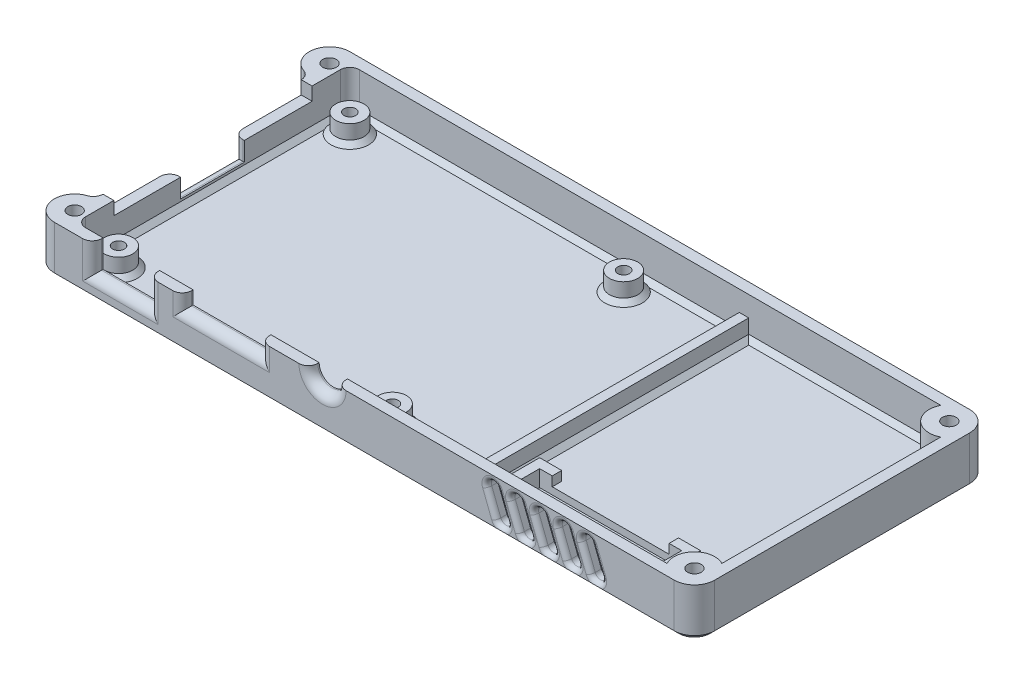
from build123d import *

# Parameters (mm, degrees)
SKETCH3_W                      = 135.6
SKETCH3_H                      = 62.6
SKETCH3_W_2                    = 131
SKETCH3_H_2                    = 58
BOSS_EXTRUDE1_DEPTH            = 10.3
SKETCH5_W                      = 131
SKETCH5_H                      = 58
BOSS_EXTRUDE2_DEPTH            = 2
SKETCH6_R                      = 3
BOSS_EXTRUDE3_DEPTH            = 4
F_2_5_2_5_DIAMETER_HOLE1_D     = 2.5
F_2_5_2_5_DIAMETER_HOLE1_DEPTH = 8
F_2_5_2_5_DIAMETER_HOLE1_TIP   = 0.751075774
SKETCH10_W                     = 2
SKETCH10_H                     = 58
BOSS_EXTRUDE4_DEPTH            = 4
CUT_EXTRUDE1_REACH             = 100.128
SKETCH11_R                     = 3
SKETCH11_W                     = 12
SKETCH11_H                     = 5.8
SKETCH11_W_2                   = 16.5
SKETCH11_H_2                   = 2.8
CUT_EXTRUDE2_REACH             = 142.276
SKETCH12_W                     = 42
SKETCH12_H                     = 2.8
SKETCH12_W_2                   = 13.5
SKETCH12_H_2                   = 6.8
FILLET6_R                      = 2
FILLET8_R                      = 2
CHAMFER1_SIZE                  = 1
FILLET9_R                      = 2
BOSS_EXTRUDE6_DEPTH            = 10.3
F_2_9_2_9_DIAMETER_HOLE2_D     = 2.9
F_2_9_2_9_DIAMETER_HOLE1_D     = 2.9
SKETCH24_R                     = 4.3
BOSS_EXTRUDE7_DEPTH            = 8.3
F_2_9_2_9_DIAMETER_HOLE5_D     = 2.9
F_2_9_2_9_DIAMETER_HOLE4_D     = 2.9
FILLET10_R                     = 4.3
FILLET18_R                     = 2
CHAMFER3_SIZE                  = 1
FILLET19_R                     = 2
FILLET20_R                     = 4.3
CHAMFER6_SIZE                  = 1
SKETCH32_W                     = 30.1
SKETCH32_H                     = 10.2
CUT_EXTRUDE4_DEPTH             = 1.5
BOSS_EXTRUDE9_DEPTH            = 2
CUT_EXTRUDE5_REACH             = 103.447
FILLET21_R                     = 1
CHAMFER7_SIZE                  = 1


# Some blends are built 0.0001 mm under size
with BuildPart() as part:
    # Sketch3 → Boss-Extrude1 (new body)
    with BuildSketch(Plane(origin=(0, 0, 0), x_dir=(1, 0, 0), z_dir=(0, 1, 0))):
        with Locations((-7.061766162, 3.105993834)):
            Rectangle(SKETCH3_W, SKETCH3_H)
        with Locations((-7.061766162, 3.105993834)):
            Rectangle(SKETCH3_W_2, SKETCH3_H_2, mode=Mode.SUBTRACT)
    extrude(amount=BOSS_EXTRUDE1_DEPTH)

    # Sketch5 → Boss-Extrude2 (add)
    with BuildSketch(Plane(origin=(0, 0, 0), x_dir=(1, 0, 0), z_dir=(0, 1, 0))):
        with Locations((-7.061766162, 3.105993834)):
            Rectangle(SKETCH5_W, SKETCH5_H)
    extrude(amount=BOSS_EXTRUDE2_DEPTH)

    # Sketch6 → Boss-Extrude3 (add)
    with BuildSketch(Plane(origin=(0, 2, 0), x_dir=(1, 0, 0), z_dir=(0, 1, 0))):
        with Locations(Location((-68.061766162, 27.605993834, 0), (0, 0, 270))):
            Circle(SKETCH6_R)
        with Locations(Location((-68.061766162, -21.394006166, 0), (0, 0, 270))):
            Circle(SKETCH6_R)
        with Locations(Location((-10.061766162, -21.394006166, 0), (0, 0, 270))):
            Circle(SKETCH6_R)
        with Locations(Location((-10.061766162, 27.605993834, 0), (0, 0, 270))):
            Circle(SKETCH6_R)
    extrude(amount=BOSS_EXTRUDE3_DEPTH)

    # Ø2.5 (2.5) Diameter Hole1
    with Locations(Plane(origin=(0, 6, 0), x_dir=(1, 0, 0), z_dir=(0, 1, 0))):
        with Locations((-68.061766162, 27.605993834), (-10.061766162, 27.605993834), (-10.061766162, -21.394006166), (-68.061766162, -21.394006166)):
            Hole(F_2_5_2_5_DIAMETER_HOLE1_D / 2, depth=F_2_5_2_5_DIAMETER_HOLE1_DEPTH)
            with Locations((0, 0, -(F_2_5_2_5_DIAMETER_HOLE1_DEPTH + F_2_5_2_5_DIAMETER_HOLE1_TIP / 2))):  # 118° drill point
                Cone(0, F_2_5_2_5_DIAMETER_HOLE1_D / 2, F_2_5_2_5_DIAMETER_HOLE1_TIP, mode=Mode.SUBTRACT)

    # Sketch10 → Boss-Extrude4 (add)
    with BuildSketch(Plane(origin=(0, 2, 0), x_dir=(1, 0, 0), z_dir=(0, 1, 0))):
        with Locations((10.938233838, 3.105993834)):
            Rectangle(SKETCH10_W, SKETCH10_H)
    extrude(amount=BOSS_EXTRUDE4_DEPTH)

    # Sketch11 → Cut-Extrude1 (cut, up to next)
    with BuildSketch(Plane.XY.offset(28.194006166), mode=Mode.PRIVATE) as cut_extrude1_sk1:
        with Locations((-18.061766162, 10.3)):
            Circle(SKETCH11_R)
    cut_extrude1_tool1 = extrude(cut_extrude1_sk1.sketch, amount=-CUT_EXTRUDE1_REACH, mode=Mode.PRIVATE) & part.part
    # Sketch11 → Cut-Extrude1 (cut, up to next)
    with BuildSketch(Plane.XY.offset(28.194006166), mode=Mode.PRIVATE) as cut_extrude1_sk2:
        with Locations((-60.861766162, 7.4)):
            Rectangle(SKETCH11_W, SKETCH11_H)
    cut_extrude1_tool2 = extrude(cut_extrude1_sk2.sketch, amount=-CUT_EXTRUDE1_REACH, mode=Mode.PRIVATE) & part.part
    # Sketch11 → Cut-Extrude1 (cut, up to next)
    with BuildSketch(Plane.XY.offset(28.194006166), mode=Mode.PRIVATE) as cut_extrude1_sk3:
        with Locations((-39.527982648, 8.9)):
            Rectangle(SKETCH11_W_2, SKETCH11_H_2)
    cut_extrude1_tool3 = extrude(cut_extrude1_sk3.sketch, amount=-CUT_EXTRUDE1_REACH, mode=Mode.PRIVATE) & part.part
    add(cut_extrude1_tool1.solids().sort_by_distance((-18.061766, 10.3, 28.194006))[0], mode=Mode.SUBTRACT)
    add(cut_extrude1_tool2.solids().sort_by_distance((-60.861766, 7.4, 28.194006))[0], mode=Mode.SUBTRACT)
    add(cut_extrude1_tool3.solids().sort_by_distance((-39.527983, 8.9, 28.194006))[0], mode=Mode.SUBTRACT)

    # Sketch12 → Cut-Extrude2 (cut, up to next)
    with BuildSketch(Plane.ZY.offset(74.861766162), mode=Mode.PRIVATE) as cut_extrude2_sk1:
        with Locations((-3.105993834, 8.9)):
            Rectangle(SKETCH12_W, SKETCH12_H)
    cut_extrude2_tool1 = extrude(cut_extrude2_sk1.sketch, amount=-CUT_EXTRUDE2_REACH, mode=Mode.PRIVATE) & part.part
    # Sketch12 → Cut-Extrude2 (cut, up to next)
    with BuildSketch(Plane.ZY.offset(74.861766162), mode=Mode.PRIVATE) as cut_extrude2_sk2:
        with Locations((-2.982922372, 6.9)):
            Rectangle(SKETCH12_W_2, SKETCH12_H_2)
    cut_extrude2_tool2 = extrude(cut_extrude2_sk2.sketch, amount=-CUT_EXTRUDE2_REACH, mode=Mode.PRIVATE) & part.part
    add(cut_extrude2_tool1.solids().sort_by_distance((-74.861766, 8.9, -3.105994))[0], mode=Mode.SUBTRACT)
    add(cut_extrude2_tool2.solids().sort_by_distance((-74.861766, 6.9, -2.982922))[0], mode=Mode.SUBTRACT)

    # Fillet6
    fillet6_edges = [part.edges().sort_by_distance(p)[0] for p in [
        (58.438233838, 6.15, -32.105993834),
    ]]
    fillet(fillet6_edges, radius=FILLET6_R)

    # Fillet8
    fillet8_edges = [part.edges().sort_by_distance(p)[0] for p in [
        (-72.561766162, 6.15, -32.105993834),
        (-72.561766162, 6.15, 25.894006166),
    ]]
    fillet(fillet8_edges, radius=FILLET8_R)

    # Chamfer1
    chamfer1_edges = [part.edges().sort_by_distance(p)[0] for p in [
        (-68.061766162, 2, -30.605993834),
        (-68.061766162, 2, 18.394006166),
        (-10.061766162, 2, 18.394006166),
        (-10.061766162, 2, -30.605993834),
    ]]
    chamfer(chamfer1_edges, length=CHAMFER1_SIZE)

    # Fillet9
    fillet9_edges = [part.edges().sort_by_distance(p)[0] for p in [
        (-60.861766162, 4.5, 28.194006166),
        (-54.861766162, 7.4, 28.194006166),
        (-47.777982648, 8.9, 28.194006166),
        (-39.527982648, 7.5, 28.194006166),
        (-31.277982648, 8.9, 28.194006166),
        (-18.061766162, 7.3, 28.194006166),
        (-74.861766162, 5.5, -9.732922372),
        (-74.861766162, 3.5, -2.982922372),
        (-74.861766162, 5.5, 3.767077628),
    ]]
    fillet(fillet9_edges, radius=FILLET9_R)

    # Sketch17 → Boss-Extrude6 (add)
    with BuildSketch(Plane(origin=(0, 0, 0), x_dir=(1, 0, 0), z_dir=(0, 1, 0))):
        with BuildLine():
            Line((-74.861766162, 34.405993834), (-74.861766162, 25.805993834))
            ThreePointArc((-74.861766162, 25.805993834), (-79.161766162, 30.105993834), (-74.861766162, 34.405993834))
        make_face()
        with BuildLine():
            Line((-74.861766162, -19.594006166), (-74.861766162, -28.194006166))
            ThreePointArc((-74.861766162, -28.194006166), (-79.161766162, -23.894006166), (-74.861766162, -19.594006166))
        make_face()
    extrude(amount=BOSS_EXTRUDE6_DEPTH)

    # Ø2.9 (2.9) Diameter Hole2 (through all)
    with Locations(Plane(origin=(0, 10.3, 0), x_dir=(1, 0, 0), z_dir=(0, 1, 0))):
        with Locations((-74.861766162, 30.105993834)):
            Hole(F_2_9_2_9_DIAMETER_HOLE2_D / 2)

    # Ø2.9 (2.9) Diameter Hole1 (through all)
    with Locations(Plane(origin=(0, 10.3, 0), x_dir=(1, 0, 0), z_dir=(0, 1, 0))):
        with Locations((-74.861766162, -23.894006166)):
            Hole(F_2_9_2_9_DIAMETER_HOLE1_D / 2)

    # Sketch24 → Boss-Extrude7 (add)
    with BuildSketch(Plane(origin=(0, 2, 0), x_dir=(1, 0, 0), z_dir=(0, 1, 0))):
        with Locations((56.438233838, -23.894006166)):
            Circle(SKETCH24_R)
        with Locations((56.438233838, 30.105993834)):
            Circle(SKETCH24_R)
    extrude(amount=BOSS_EXTRUDE7_DEPTH)

    # Ø2.9 (2.9) Diameter Hole5 (through all)
    with Locations(Plane(origin=(0, 10.3, 0), x_dir=(1, 0, 0), z_dir=(0, 1, 0))):
        with Locations((56.438233838, -23.894006166)):
            Hole(F_2_9_2_9_DIAMETER_HOLE5_D / 2)

    # Ø2.9 (2.9) Diameter Hole4 (through all)
    with Locations(Plane(origin=(0, 10.3, 0), x_dir=(1, 0, 0), z_dir=(0, 1, 0))):
        with Locations((56.438233838, 30.105993834)):
            Hole(F_2_9_2_9_DIAMETER_HOLE4_D / 2)

    # Fillet10
    fillet10_edges = [part.edges().sort_by_distance(p)[0] for p in [
        (60.738233838, 5.15, -34.405993834),
    ]]
    fillet(fillet10_edges, radius=FILLET10_R - 0.0001)  # a hair under: the kernel refuses the full size

    # Fillet18
    fillet18_edges = [part.edges().sort_by_distance(p)[0] for p in [
        (-74.861766162, 5.15, -25.805993834),
        (-74.861766162, 5.15, 19.594006166),
    ]]
    fillet(fillet18_edges, radius=FILLET18_R)

    # Chamfer3
    chamfer3_edges = [part.edges().sort_by_distance(p)[0] for p in [
        (-79.105793795, 0, -30.797535193),
        (-9.211716162, 0, -34.405993834),
        (59.478822286, 0, -33.146582283),
        (-79.105793795, 0, 24.585547524),
        (-74.861766162, 0, -3.105993834),
        (-75.2385223, 0, 19.088261462),
        (-75.2385223, 0, -25.300249131),
        (60.738233838, 0, -0.956043834),
        (-7.061766162, 0, 28.194006166),
    ]]
    chamfer(chamfer3_edges, length=CHAMFER3_SIZE)

    # Fillet19
    fillet19_edges = [part.edges().sort_by_distance(p)[0] for p in [
        (-66.861766162, 6.4, 28.194006166),
    ]]
    fillet(fillet19_edges, radius=FILLET19_R)

    # Fillet20
    # the kernel refuses this fillet: 4.3 mm, written as the material it takes off along each edge
    with BuildSketch(Plane(origin=(60.738233838, -9.75, 28.194006166), x_dir=(-1, 0, 0), z_dir=(0, 1, 0))) as fillet20_piece_1:
        with BuildLine():
            CenterArc((FILLET20_R, -FILLET20_R), FILLET20_R, 90, 90)
            Line((0, -FILLET20_R), (0, 0))
            Line((0, 0), (FILLET20_R, 0))
        make_face()
    extrude(amount=30.8, mode=Mode.SUBTRACT)

    # Chamfer5
    # the kernel refuses this chamfer: 1 mm, written as the material it adds along each edge
    with BuildSketch(Plane(origin=(-72.561766162, 2, 23.894006166), x_dir=(-0.027495876610568366, 0.9996219169112972, 0), z_dir=(0, 0, -1))) as chamfer5_piece_1:
        with BuildLine():
            Line((1.028673195, 0), (-0.056547155, 1.027117794))
            Line((-0.056547155, 1.027117794), (-0.076539593, 1.026567876))
            ThreePointArc((-0.076539593, 1.026567876), (-0.034129227, 0.51339783), (-0.019992438, -0.000549918))
            Line((-0.019992438, -0.000549918), (0.000549918, -0.019992438))
            ThreePointArc((0.000549918, -0.019992438), (0.514497665, -0.00585565), (1.029223113, -0.019992438))
            Line((1.029223113, -0.019992438), (1.028673195, 0))
        make_face()
    extrude(amount=54)
    with BuildSketch(Plane(origin=(-70.561766162, 2, 23.894006166), x_dir=(0, 0, 1), z_dir=(1, 0, 0))) as chamfer5_piece_2:
        with BuildLine():
            Line((0.971715729, 0.028284271), (2.028284271, -1.028284271))
            Line((2.028284271, -1.028284271), (2.048284271, -1.028284271))
            ThreePointArc((2.048284271, -1.028284271), (2.02, -0.514142136), (2.02, 0))
            Line((2.02, 0), (2, 0.02))
            ThreePointArc((2, 0.02), (1.485857864, 0.02), (0.971715729, 0.048284271))
            Line((0.971715729, 0.048284271), (0.971715729, 0.028284271))
        make_face()
    revolve(axis=Axis((-70.561766162, 2, 23.894006166), (0, -1, 0)), revolution_arc=90)
    with BuildSketch(Plane(origin=(-70.561766162, 2, -30.105993834), x_dir=(0, 0, -1), z_dir=(1, 0, 0))) as chamfer5_piece_3:
        with BuildLine():
            Line((2.028284271, 1.028284271), (0.971715729, -0.028284271))
            Line((0.971715729, -0.028284271), (0.971715729, -0.048284271))
            ThreePointArc((0.971715729, -0.048284271), (1.485857864, -0.02), (2, -0.02))
            Line((2, -0.02), (2.02, 0))
            ThreePointArc((2.02, 0), (2.02, 0.514142136), (2.048284271, 1.028284271))
            Line((2.048284271, 1.028284271), (2.028284271, 1.028284271))
        make_face()
    revolve(axis=Axis((-70.561766162, 2, -30.105993834), (0, 1, 0)), revolution_arc=90)
    with BuildSketch(Plane(origin=(9.938233838, 2, 25.894006166), x_dir=(0, 0.9996219169112968, 0.027495876610585623), z_dir=(-1, 0, 0)), Plane(origin=(-70.561766162, 2, -32.105993834), x_dir=(0, 0.9996219169112968, -0.027495876610589075), z_dir=(1, 0, 0))) as chamfer5_piece_4:
        with BuildLine():
            Line((1.028673195, 0), (-0.056547155, 1.027117794))
            Line((-0.056547155, 1.027117794), (-0.076539593, 1.026567876))
            ThreePointArc((-0.076539593, 1.026567876), (-0.034129227, 0.51339783), (-0.019992438, -0.000549918))
            Line((-0.019992438, -0.000549918), (0.000549918, -0.019992438))
            ThreePointArc((0.000549918, -0.019992438), (0.514497665, -0.00585565), (1.029223113, -0.019992438))
            Line((1.029223113, -0.019992438), (1.028673195, 0))
        make_face()
    extrude(amount=80.5)
    with BuildSketch(Plane(origin=(9.938233838, 2, 25.894006166), x_dir=(0.027495876610585623, 0.9996219169112968, 0), z_dir=(0, 0, -1)), Plane(origin=(11.938233838, 2, -32.105993834), x_dir=(-0.027495876610585623, 0.9996219169112968, 0), z_dir=(0, 0, 1))) as chamfer5_piece_5:
        with BuildLine():
            Line((1.028673195, 0), (-0.056547155, -1.027117794))
            Line((-0.056547155, -1.027117794), (-0.076539593, -1.026567876))
            ThreePointArc((-0.076539593, -1.026567876), (-0.034129227, -0.51339783), (-0.019992438, 0.000549918))
            Line((-0.019992438, 0.000549918), (0.000549918, 0.019992438))
            ThreePointArc((0.000549918, 0.019992438), (0.514497665, 0.00585565), (1.029223113, 0.019992438))
            Line((1.029223113, 0.019992438), (1.028673195, 0))
        make_face()
    extrude(amount=58)
    with BuildSketch(Plane(origin=(11.938233838, 2, -32.105993834), x_dir=(0, 0.9996219169112968, -0.027495876610589075), z_dir=(1, 0, 0))) as chamfer5_piece_6_section:
        with BuildLine():
            Line((1.028673195, 0), (-0.056547155, 1.027117794))
            Line((-0.056547155, 1.027117794), (-0.076539593, 1.026567876))
            ThreePointArc((-0.076539593, 1.026567876), (-0.034129227, 0.51339783), (-0.019992438, -0.000549918))
            Line((-0.019992438, -0.000549918), (0.000549918, -0.019992438))
            ThreePointArc((0.000549918, -0.019992438), (0.514497665, -0.00585565), (1.029223113, -0.019992438))
            Line((1.029223113, -0.019992438), (1.028673195, 0))
        make_face()
    chamfer5_piece_6 = extrude(amount=43.265109726, mode=Mode.PRIVATE)
    chamfer5_piece_6 = chamfer5_piece_6 - Plane(origin=(56.438233838, 2.330131969, -30.105993834), x_dir=(1, 0, 0), z_dir=(0, -1, 0)) * Cylinder(4.3, 91, mode=Mode.PRIVATE)
    add(chamfer5_piece_6)
    with BuildSketch(Plane(origin=(9.938233838, 2, 28.465689154), x_dir=(0.027495876610585623, 0.9996219169112968, 0), z_dir=(0, 0, -1))) as chamfer5_piece_7a_section:
        with BuildLine():
            Line((1.028673195, 0), (-0.056547155, -1.027117794))
            Line((-0.056547155, -1.027117794), (-0.076539593, -1.026567876))
            ThreePointArc((-0.076539593, -1.026567876), (-0.034129227, -0.51339783), (-0.019992438, 0.000549918))
            Line((-0.019992438, 0.000549918), (0.000549918, 0.019992438))
            ThreePointArc((0.000549918, 0.019992438), (0.514497665, 0.00585565), (1.029223113, 0.019992438))
            Line((1.029223113, 0.019992438), (1.028673195, 0))
        make_face()
    chamfer5_piece_7a = extrude(amount=60.571682988, mode=Mode.PRIVATE)
    chamfer5_piece_7a = split(chamfer5_piece_7a, bisect_by=Plane(origin=(9.608440211, 2.329793627, 25.894006166), z_dir=(0, 0, 1)), keep=Keep.TOP, mode=Mode.PRIVATE)
    with BuildSketch(Plane(origin=(12.509916826, 2, 25.894006166), x_dir=(0, 0.9996219169112968, 0.027495876610585623), z_dir=(-1, 0, 0))) as chamfer5_piece_7b_section:
        with BuildLine():
            Line((1.028673195, 0), (-0.056547155, 1.027117794))
            Line((-0.056547155, 1.027117794), (-0.076539593, 1.026567876))
            ThreePointArc((-0.076539593, 1.026567876), (-0.034129227, 0.51339783), (-0.019992438, -0.000549918))
            Line((-0.019992438, -0.000549918), (0.000549918, -0.019992438))
            ThreePointArc((0.000549918, -0.019992438), (0.514497665, -0.00585565), (1.029223113, -0.019992438))
            Line((1.029223113, -0.019992438), (1.028673195, 0))
        make_face()
    chamfer5_piece_7b = extrude(amount=83.071682988, mode=Mode.PRIVATE)
    chamfer5_piece_7b = split(chamfer5_piece_7b, bisect_by=Plane(origin=(9.938233838, 2.329793627, 25.564212539), z_dir=(1, 0, 0)), keep=Keep.TOP, mode=Mode.PRIVATE)
    chamfer5_piece_7 = chamfer5_piece_7a & chamfer5_piece_7b
    add(chamfer5_piece_7)
    with BuildSketch(Plane(origin=(-70.561766162, 2, -32.105993834), x_dir=(0, 0.9996219169112968, -0.027495876610589075), z_dir=(1, 0, 0))) as chamfer5_piece_8a_section:
        with BuildLine():
            Line((1.028673195, 0), (-0.056547155, 1.027117794))
            Line((-0.056547155, 1.027117794), (-0.076539593, 1.026567876))
            ThreePointArc((-0.076539593, 1.026567876), (-0.034129227, 0.51339783), (-0.019992438, -0.000549918))
            Line((-0.019992438, -0.000549918), (0.000549918, -0.019992438))
            ThreePointArc((0.000549918, -0.019992438), (0.514497665, -0.00585565), (1.029223113, -0.019992438))
            Line((1.029223113, -0.019992438), (1.028673195, 0))
        make_face()
    chamfer5_piece_8a = extrude(amount=83.071682988, mode=Mode.PRIVATE)
    chamfer5_piece_8a = split(chamfer5_piece_8a, bisect_by=Plane(origin=(9.938233838, 2.329793627, -31.776200208), z_dir=(1, 0, 0)), keep=Keep.TOP, mode=Mode.PRIVATE)
    with BuildSketch(Plane(origin=(9.938233838, 2, 25.894006166), x_dir=(0.027495876610585623, 0.9996219169112968, 0), z_dir=(0, 0, -1))) as chamfer5_piece_8b_section:
        with BuildLine():
            Line((1.028673195, 0), (-0.056547155, -1.027117794))
            Line((-0.056547155, -1.027117794), (-0.076539593, -1.026567876))
            ThreePointArc((-0.076539593, -1.026567876), (-0.034129227, -0.51339783), (-0.019992438, 0.000549918))
            Line((-0.019992438, 0.000549918), (0.000549918, 0.019992438))
            ThreePointArc((0.000549918, 0.019992438), (0.514497665, 0.00585565), (1.029223113, 0.019992438))
            Line((1.029223113, 0.019992438), (1.028673195, 0))
        make_face()
    chamfer5_piece_8b = extrude(amount=60.571682988, mode=Mode.PRIVATE)
    chamfer5_piece_8b = split(chamfer5_piece_8b, bisect_by=Plane(origin=(9.608440211, 2.329793627, -32.105993834), z_dir=(0, 0, -1)), keep=Keep.TOP, mode=Mode.PRIVATE)
    chamfer5_piece_8 = chamfer5_piece_8a & chamfer5_piece_8b
    add(chamfer5_piece_8)
    with BuildSketch(Plane(origin=(9.36655085, 2, -32.105993834), x_dir=(0, 0.9996219169112968, -0.027495876610589075), z_dir=(1, 0, 0))) as chamfer5_piece_9a_section:
        with BuildLine():
            Line((1.028673195, 0), (-0.056547155, 1.027117794))
            Line((-0.056547155, 1.027117794), (-0.076539593, 1.026567876))
            ThreePointArc((-0.076539593, 1.026567876), (-0.034129227, 0.51339783), (-0.019992438, -0.000549918))
            Line((-0.019992438, -0.000549918), (0.000549918, -0.019992438))
            ThreePointArc((0.000549918, -0.019992438), (0.514497665, -0.00585565), (1.029223113, -0.019992438))
            Line((1.029223113, -0.019992438), (1.028673195, 0))
        make_face()
    chamfer5_piece_9a = extrude(amount=45.836792714, mode=Mode.PRIVATE)
    chamfer5_piece_9a = split(chamfer5_piece_9a, bisect_by=Plane(origin=(11.938233838, 2.329793627, -31.776200208), z_dir=(-1, 0, 0)), keep=Keep.TOP, mode=Mode.PRIVATE)
    with BuildSketch(Plane(origin=(11.938233838, 2, -34.677676822), x_dir=(-0.027495876610585623, 0.9996219169112968, 0), z_dir=(0, 0, 1))) as chamfer5_piece_9b_section:
        with BuildLine():
            Line((1.028673195, 0), (-0.056547155, -1.027117794))
            Line((-0.056547155, -1.027117794), (-0.076539593, -1.026567876))
            ThreePointArc((-0.076539593, -1.026567876), (-0.034129227, -0.51339783), (-0.019992438, 0.000549918))
            Line((-0.019992438, 0.000549918), (0.000549918, 0.019992438))
            ThreePointArc((0.000549918, 0.019992438), (0.514497665, 0.00585565), (1.029223113, 0.019992438))
            Line((1.029223113, 0.019992438), (1.028673195, 0))
        make_face()
    chamfer5_piece_9b = extrude(amount=60.571682988, mode=Mode.PRIVATE)
    chamfer5_piece_9b = split(chamfer5_piece_9b, bisect_by=Plane(origin=(12.268027465, 2.329793627, -32.105993834), z_dir=(0, 0, -1)), keep=Keep.TOP, mode=Mode.PRIVATE)
    chamfer5_piece_9 = chamfer5_piece_9a & chamfer5_piece_9b
    add(chamfer5_piece_9)

    # Chamfer6
    chamfer6_edges = [part.edges().sort_by_distance(p)[0] for p in [
        (58.438233838, 2, -3.105993834),
    ]]
    chamfer(chamfer6_edges, length=CHAMFER6_SIZE)

    # Sketch32 → Cut-Extrude4 (cut)
    with BuildSketch(Plane(origin=(0, 2, 0), x_dir=(1, 0, 0), z_dir=(0, 1, 0))):
        with Locations((30.488233838, -20.794006166)):
            Rectangle(SKETCH32_W, SKETCH32_H)
    extrude(amount=-CUT_EXTRUDE4_DEPTH, mode=Mode.SUBTRACT)

    # Sketch33 → Boss-Extrude9 (add)
    with BuildSketch(Plane(origin=(0, 2, 0), x_dir=(1, 0, 0), z_dir=(0, 1, 0))):
        Polygon((15.438233838, -15.694006166), (15.438233838, -25.894006166), (13.438233838, -25.894006166), (13.438233838, -13.694006166), (18.108333222, -13.694006166), (18.108333222, -15.694006166), align=None)
        Polygon((47.538233838, -13.694006166), (47.538233838, -20.882174736), (45.538233838, -20.882174736), (45.538233838, -15.694006166), (42.868134454, -15.694006166), (42.868134454, -13.694006166), align=None)
    extrude(amount=BOSS_EXTRUDE9_DEPTH)

    # Sketch34 → Cut-Extrude5 (cut, up to next)
    with BuildSketch(Plane.XY.offset(28.194006166), mode=Mode.PRIVATE) as cut_extrude5_sk1:
        with BuildLine():
            Line((19.140183986, 8.196301764), (21.05650073, 3.254871795))
            ThreePointArc((21.05650073, 3.254871795), (20.34303063, 1.637478703), (18.725637537, 2.350948803))
            Line((18.725637537, 2.350948803), (16.809320793, 7.292378772))
            ThreePointArc((16.809320793, 7.292378772), (17.522790894, 8.909771864), (19.140183986, 8.196301764))
        make_face()
    cut_extrude5_tool1 = extrude(cut_extrude5_sk1.sketch, amount=-CUT_EXTRUDE5_REACH, mode=Mode.PRIVATE) & part.part
    # Sketch34 → Cut-Extrude5 (cut, up to next)
    with BuildSketch(Plane.XY.offset(28.194006166), mode=Mode.PRIVATE) as cut_extrude5_sk2:
        with BuildLine():
            Line((24.140183986, 8.196301764), (26.05650073, 3.254871795))
            ThreePointArc((26.05650073, 3.254871795), (25.34303063, 1.637478703), (23.725637537, 2.350948803))
            Line((23.725637537, 2.350948803), (21.809320793, 7.292378772))
            ThreePointArc((21.809320793, 7.292378772), (22.522790894, 8.909771864), (24.140183986, 8.196301764))
        make_face()
    cut_extrude5_tool2 = extrude(cut_extrude5_sk2.sketch, amount=-CUT_EXTRUDE5_REACH, mode=Mode.PRIVATE) & part.part
    # Sketch34 → Cut-Extrude5 (cut, up to next)
    with BuildSketch(Plane.XY.offset(28.194006166), mode=Mode.PRIVATE) as cut_extrude5_sk3:
        with BuildLine():
            Line((29.140183986, 8.196301764), (31.05650073, 3.254871795))
            ThreePointArc((31.05650073, 3.254871795), (30.34303063, 1.637478703), (28.725637537, 2.350948803))
            Line((28.725637537, 2.350948803), (26.809320793, 7.292378772))
            ThreePointArc((26.809320793, 7.292378772), (27.522790894, 8.909771864), (29.140183986, 8.196301764))
        make_face()
    cut_extrude5_tool3 = extrude(cut_extrude5_sk3.sketch, amount=-CUT_EXTRUDE5_REACH, mode=Mode.PRIVATE) & part.part
    # Sketch34 → Cut-Extrude5 (cut, up to next)
    with BuildSketch(Plane.XY.offset(28.194006166), mode=Mode.PRIVATE) as cut_extrude5_sk4:
        with BuildLine():
            Line((34.140183986, 8.196301764), (36.05650073, 3.254871795))
            ThreePointArc((36.05650073, 3.254871795), (35.34303063, 1.637478703), (33.725637537, 2.350948803))
            Line((33.725637537, 2.350948803), (31.809320793, 7.292378772))
            ThreePointArc((31.809320793, 7.292378772), (32.522790894, 8.909771864), (34.140183986, 8.196301764))
        make_face()
    cut_extrude5_tool4 = extrude(cut_extrude5_sk4.sketch, amount=-CUT_EXTRUDE5_REACH, mode=Mode.PRIVATE) & part.part
    # Sketch34 → Cut-Extrude5 (cut, up to next)
    with BuildSketch(Plane.XY.offset(28.194006166), mode=Mode.PRIVATE) as cut_extrude5_sk5:
        with BuildLine():
            Line((39.140183986, 8.196301764), (41.05650073, 3.254871795))
            ThreePointArc((41.05650073, 3.254871795), (40.34303063, 1.637478703), (38.725637537, 2.350948803))
            Line((38.725637537, 2.350948803), (36.809320793, 7.292378772))
            ThreePointArc((36.809320793, 7.292378772), (37.522790894, 8.909771864), (39.140183986, 8.196301764))
        make_face()
    cut_extrude5_tool5 = extrude(cut_extrude5_sk5.sketch, amount=-CUT_EXTRUDE5_REACH, mode=Mode.PRIVATE) & part.part
    add(cut_extrude5_tool1.solids().sort_by_distance((18.932911, 5.273625, 28.194006))[0], mode=Mode.SUBTRACT)
    add(cut_extrude5_tool2.solids().sort_by_distance((23.932911, 5.273625, 28.194006))[0], mode=Mode.SUBTRACT)
    add(cut_extrude5_tool3.solids().sort_by_distance((28.932911, 5.273625, 28.194006))[0], mode=Mode.SUBTRACT)
    add(cut_extrude5_tool4.solids().sort_by_distance((33.932911, 5.273625, 28.194006))[0], mode=Mode.SUBTRACT)
    add(cut_extrude5_tool5.solids().sort_by_distance((38.932911, 5.273625, 28.194006))[0], mode=Mode.SUBTRACT)

    # Fillet21
    # the kernel refuses this fillet: 1 mm, written as the material it takes off along each edge
    with BuildSketch(Plane(origin=(17.97475239, 7.744340268, 28.194006166), x_dir=(-0.9323452771444899, -0.3615691969545585, 0), z_dir=(0.3615691969545585, -0.9323452771444899, 0))) as fillet21_piece_1:
        with BuildLine():
            CenterArc((1.25 + FILLET21_R, FILLET21_R), FILLET21_R, 180, 90)
            Line((1.25 + FILLET21_R, 0), (1.25, 0))
            Line((1.25, 0), (1.25, FILLET21_R))
        make_face()
    revolve(axis=Axis((17.97475239, 7.744340268, 28.194006166), (0, 0, -1)), revolution_arc=180, mode=Mode.SUBTRACT)
    with BuildSketch(Plane(origin=(18.725637537, 2.350948803, 28.194006166), x_dir=(0, 0, -1), z_dir=(-0.36156919695456985, 0.9323452771444856, 0)), Plane(origin=(19.140183986, 8.196301764, 28.194006166), x_dir=(0, 0, -1), z_dir=(0.3615691969545619, -0.9323452771444886, 0)), Plane(origin=(23.725637537, 2.350948803, 28.194006166), x_dir=(0, 0, -1), z_dir=(-0.3615691969545605, 0.9323452771444891, 0)), Plane(origin=(24.140183986, 8.196301764, 28.194006166), x_dir=(0, 0, -1), z_dir=(0.3615691969545605, -0.9323452771444891, 0)), Plane(origin=(28.725637537, 2.350948803, 28.194006166), x_dir=(0, 0, -1), z_dir=(-0.3615691969545601, 0.9323452771444893, 0)), Plane(origin=(29.140183986, 8.196301764, 28.194006166), x_dir=(0, 0, -1), z_dir=(0.3615691969545628, -0.9323452771444882, 0)), Plane(origin=(33.725637537, 2.350948803, 28.194006166), x_dir=(0, 0, -1), z_dir=(-0.3615691969545628, 0.9323452771444882, 0)), Plane(origin=(34.140183986, 8.196301764, 28.194006166), x_dir=(0, 0, -1), z_dir=(0.3615691969545605, -0.9323452771444891, 0)), Plane(origin=(38.725637537, 2.350948803, 28.194006166), x_dir=(0, 0, -1), z_dir=(-0.3615691969545605, 0.9323452771444891, 0)), Plane(origin=(39.140183986, 8.196301764, 28.194006166), x_dir=(0, 0, -1), z_dir=(0.36156919695455964, -0.9323452771444896, 0))) as fillet21_piece_2:
        with BuildLine():
            CenterArc((FILLET21_R, FILLET21_R), FILLET21_R, 180, 90)
            Line((0, FILLET21_R), (0, 0))
            Line((0, 0), (FILLET21_R, 0))
        make_face()
    extrude(amount=5.3, mode=Mode.SUBTRACT)
    with BuildSketch(Plane(origin=(19.891069134, 2.802910299, 28.194006166), x_dir=(0.9323452771444968, 0.36156919695454104, 0), z_dir=(-0.36156919695454104, 0.9323452771444968, 0))) as fillet21_piece_3:
        with BuildLine():
            CenterArc((1.25 + FILLET21_R, FILLET21_R), FILLET21_R, 180, 90)
            Line((1.25 + FILLET21_R, 0), (1.25, 0))
            Line((1.25, 0), (1.25, FILLET21_R))
        make_face()
    revolve(axis=Axis((19.891069134, 2.802910299, 28.194006166), (0, 0, -1)), revolution_arc=180, mode=Mode.SUBTRACT)
    with BuildSketch(Plane(origin=(22.97475239, 7.744340268, 28.194006166), x_dir=(-0.9323452771444899, -0.3615691969545585, 0), z_dir=(0.3615691969545585, -0.9323452771444899, 0))) as fillet21_piece_4:
        with BuildLine():
            CenterArc((1.25 + FILLET21_R, FILLET21_R), FILLET21_R, 180, 90)
            Line((1.25 + FILLET21_R, 0), (1.25, 0))
            Line((1.25, 0), (1.25, FILLET21_R))
        make_face()
    revolve(axis=Axis((22.97475239, 7.744340268, 28.194006166), (0, 0, -1)), revolution_arc=180, mode=Mode.SUBTRACT)
    with BuildSketch(Plane(origin=(24.891069134, 2.802910299, 28.194006166), x_dir=(0.9323452771444884, 0.3615691969545626, 0), z_dir=(-0.3615691969545626, 0.9323452771444884, 0))) as fillet21_piece_5:
        with BuildLine():
            CenterArc((1.25 + FILLET21_R, FILLET21_R), FILLET21_R, 180, 90)
            Line((1.25 + FILLET21_R, 0), (1.25, 0))
            Line((1.25, 0), (1.25, FILLET21_R))
        make_face()
    revolve(axis=Axis((24.891069134, 2.802910299, 28.194006166), (0, 0, -1)), revolution_arc=180, mode=Mode.SUBTRACT)
    with BuildSketch(Plane(origin=(27.97475239, 7.744340268, 28.194006166), x_dir=(-0.9323452771444901, -0.36156919695455786, 0), z_dir=(0.36156919695455786, -0.9323452771444901, 0))) as fillet21_piece_6:
        with BuildLine():
            CenterArc((1.25 + FILLET21_R, FILLET21_R), FILLET21_R, 180, 90)
            Line((1.25 + FILLET21_R, 0), (1.25, 0))
            Line((1.25, 0), (1.25, FILLET21_R))
        make_face()
    revolve(axis=Axis((27.97475239, 7.744340268, 28.194006166), (0, 0, -1)), revolution_arc=180, mode=Mode.SUBTRACT)
    with BuildSketch(Plane(origin=(29.891069134, 2.802910299, 28.194006166), x_dir=(0.9323452771444861, 0.3615691969545684, 0), z_dir=(-0.3615691969545684, 0.9323452771444861, 0))) as fillet21_piece_7:
        with BuildLine():
            CenterArc((1.25 + FILLET21_R, FILLET21_R), FILLET21_R, 180, 90)
            Line((1.25 + FILLET21_R, 0), (1.25, 0))
            Line((1.25, 0), (1.25, FILLET21_R))
        make_face()
    revolve(axis=Axis((29.891069134, 2.802910299, 28.194006166), (0, 0, -1)), revolution_arc=180, mode=Mode.SUBTRACT)
    with BuildSketch(Plane(origin=(32.97475239, 7.744340268, 28.194006166), x_dir=(-0.9323452771444872, -0.36156919695456535, 0), z_dir=(0.36156919695456535, -0.9323452771444872, 0))) as fillet21_piece_8:
        with BuildLine():
            CenterArc((1.25 + FILLET21_R, FILLET21_R), FILLET21_R, 180, 90)
            Line((1.25 + FILLET21_R, 0), (1.25, 0))
            Line((1.25, 0), (1.25, FILLET21_R))
        make_face()
    revolve(axis=Axis((32.97475239, 7.744340268, 28.194006166), (0, 0, -1)), revolution_arc=180, mode=Mode.SUBTRACT)
    with BuildSketch(Plane(origin=(34.891069134, 2.802910299, 28.194006166), x_dir=(0.9323452771444815, 0.36156919695458034, 0), z_dir=(-0.36156919695458034, 0.9323452771444815, 0))) as fillet21_piece_9:
        with BuildLine():
            CenterArc((1.25 + FILLET21_R, FILLET21_R), FILLET21_R, 180, 90)
            Line((1.25 + FILLET21_R, 0), (1.25, 0))
            Line((1.25, 0), (1.25, FILLET21_R))
        make_face()
    revolve(axis=Axis((34.891069134, 2.802910299, 28.194006166), (0, 0, -1)), revolution_arc=180, mode=Mode.SUBTRACT)
    with BuildSketch(Plane(origin=(37.97475239, 7.744340268, 28.194006166), x_dir=(-0.9323452771444841, -0.3615691969545735, 0), z_dir=(0.3615691969545735, -0.9323452771444841, 0))) as fillet21_piece_10:
        with BuildLine():
            CenterArc((1.25 + FILLET21_R, FILLET21_R), FILLET21_R, 180, 90)
            Line((1.25 + FILLET21_R, 0), (1.25, 0))
            Line((1.25, 0), (1.25, FILLET21_R))
        make_face()
    revolve(axis=Axis((37.97475239, 7.744340268, 28.194006166), (0, 0, -1)), revolution_arc=180, mode=Mode.SUBTRACT)
    with BuildSketch(Plane(origin=(39.891069134, 2.802910299, 28.194006166), x_dir=(0.9323452771444932, 0.36156919695455003, 0), z_dir=(-0.36156919695455003, 0.9323452771444932, 0))) as fillet21_piece_11:
        with BuildLine():
            CenterArc((1.25 + FILLET21_R, FILLET21_R), FILLET21_R, 180, 90)
            Line((1.25 + FILLET21_R, 0), (1.25, 0))
            Line((1.25, 0), (1.25, FILLET21_R))
        make_face()
    revolve(axis=Axis((39.891069134, 2.802910299, 28.194006166), (0, 0, -1)), revolution_arc=180, mode=Mode.SUBTRACT)

    # Chamfer7
    chamfer7_edges = [part.edges().sort_by_distance(p)[0] for p in [
        (59.478792997, 0, 26.934565325),
    ]]
    chamfer(chamfer7_edges, length=CHAMFER7_SIZE - 0.0001)  # a hair under: the kernel refuses the full size


solid = part.part
